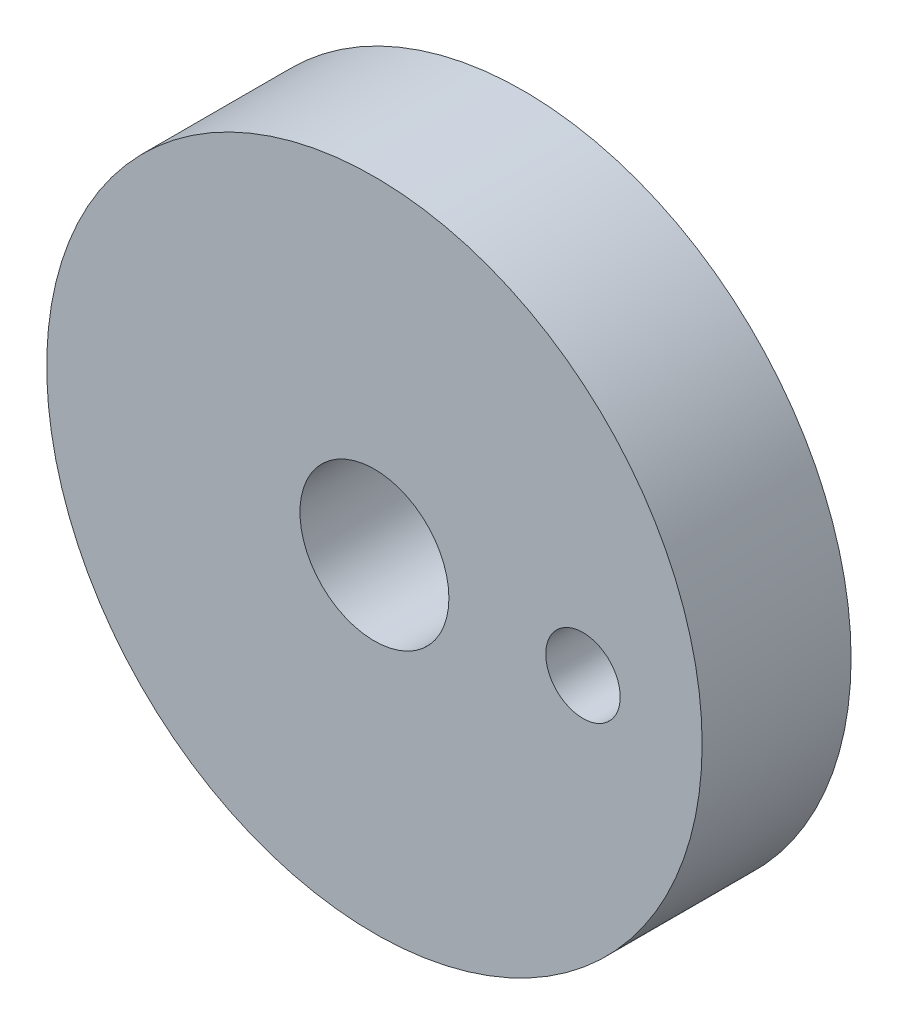
from build123d import *

# Parameters (mm, degrees)
SKETCH1_R           = 13.97
BOSS_EXTRUDE1_DEPTH = 6.35
SKETCH2_R           = 1.5875
SKETCH2_R_2         = 3.175
CUT_EXTRUDE1_DEPTH  = 21.751970991


with BuildPart() as part:
    # Sketch1 → Boss-Extrude1 (new body)
    with BuildSketch(Plane.XY):
        Circle(SKETCH1_R)
    extrude(amount=BOSS_EXTRUDE1_DEPTH)

    # Sketch2 → Cut-Extrude1 (cut, through all)
    with BuildSketch(Plane.XY.offset(6.35)):
        with Locations((8.89, 0)):
            Circle(SKETCH2_R)
        Circle(SKETCH2_R_2)
    extrude(amount=-CUT_EXTRUDE1_DEPTH, mode=Mode.SUBTRACT)


solid = part.part
